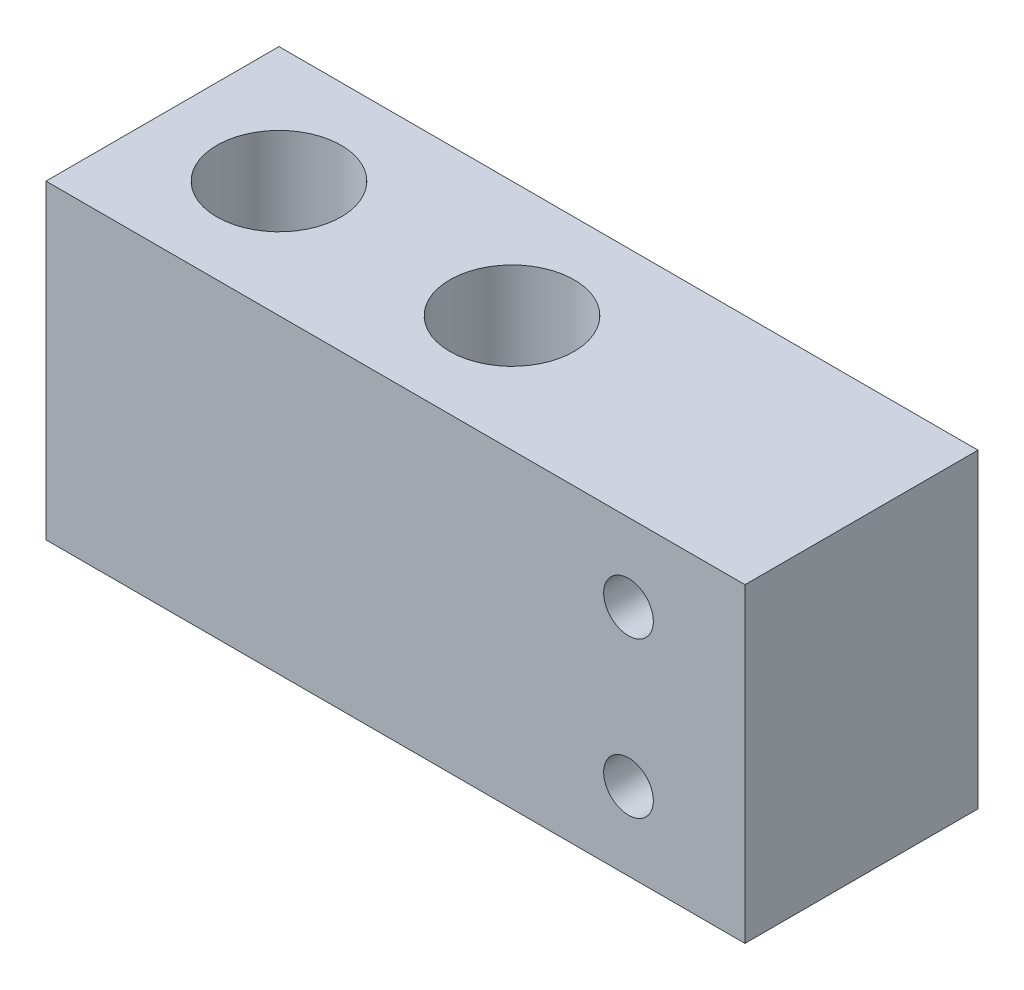
from build123d import *

# Parameters (mm, degrees)
SKETCH2_W           = 45
SKETCH2_H           = 15
SKETCH2_R           = 4
BOSS_EXTRUDE1_DEPTH = 10
BOSS_EXTRUDE2_START = -10
SKETCH2_3_W         = 45
SKETCH2_3_H         = 15
SKETCH2_3_R         = 4
BOSS_EXTRUDE2_DEPTH = 10
SKETCH4_R           = 1.6
CUT_EXTRUDE1_DEPTH  = 36
CUT_EXTRUDE2_START  = -6.25
SKETCH4_3_R         = 1.6
CUT_EXTRUDE2_DEPTH  = 2.5


with BuildPart() as part:
    # Sketch2 → Boss-Extrude1 (new body)
    with BuildSketch(Plane(origin=(0, 0, 0), x_dir=(1, 0, 0), z_dir=(0, 1, 0))):
        with Locations((7.5, 0)):
            Rectangle(SKETCH2_W, SKETCH2_H)
        with Locations((-7.5, 0)):
            Circle(SKETCH2_R, mode=Mode.SUBTRACT)
        with Locations((7.5, 0)):
            Circle(SKETCH2_R, mode=Mode.SUBTRACT)
    extrude(amount=BOSS_EXTRUDE1_DEPTH)

    # Sketch2<3> → Boss-Extrude2 (add)
    with BuildSketch(Plane(origin=(0, 0, 0), x_dir=(1, 0, 0), z_dir=(0, 1, 0)).offset(BOSS_EXTRUDE2_START)):
        with Locations((7.5, 0)):
            Rectangle(SKETCH2_3_W, SKETCH2_3_H)
        with Locations((-7.5, 0)):
            Circle(SKETCH2_3_R, mode=Mode.SUBTRACT)
        with Locations((7.5, 0)):
            Circle(SKETCH2_3_R, mode=Mode.SUBTRACT)
    extrude(amount=BOSS_EXTRUDE2_DEPTH)

    # Sketch4 → Cut-Extrude1 (cut, through all)
    with BuildSketch(Plane.XY.offset(7.5)):
        with Locations((22.5, 5)):
            Circle(SKETCH4_R)
        with Locations((22.5, -5)):
            Circle(SKETCH4_R)
        with Locations((-22.5, -5)):
            Circle(SKETCH4_R)
        with Locations((-22.5, 5)):
            Circle(SKETCH4_R)
    extrude(amount=-CUT_EXTRUDE1_DEPTH, mode=Mode.SUBTRACT)

    # Sketch4<3> → Cut-Extrude2 (cut)
    # profile 1 of 4: a face of its own
    with BuildSketch(Plane.XY.offset(7.5).offset(CUT_EXTRUDE2_START)):
        Polygon((-22.5, 8.435234102), (-25.475, 6.717617051), (-25.475, 3.282382949), (-22.5, 1.564765898), (-19.525, 3.282382949), (-19.525, 6.717617051), align=None)
        with Locations((-22.5, 5)):
            Circle(SKETCH4_3_R, mode=Mode.SUBTRACT)
    # profile 2 of 4: a face of its own
    with BuildSketch(Plane.XY.offset(7.5).offset(CUT_EXTRUDE2_START)):
        Polygon((22.5, 8.435234102), (19.525, 6.717617051), (19.525, 3.282382949), (22.5, 1.564765898), (25.475, 3.282382949), (25.475, 6.717617051), align=None)
        with Locations((22.5, 5)):
            Circle(SKETCH4_3_R, mode=Mode.SUBTRACT)
    # profile 3 of 4: a face of its own
    with BuildSketch(Plane.XY.offset(7.5).offset(CUT_EXTRUDE2_START)):
        Polygon((-22.5, -8.435234102), (-19.525, -6.717617051), (-19.525, -3.282382949), (-22.5, -1.564765898), (-25.475, -3.282382949), (-25.475, -6.717617051), align=None)
        with Locations((-22.5, -5)):
            Circle(SKETCH4_3_R, mode=Mode.SUBTRACT)
    # profile 4 of 4: a face of its own
    with BuildSketch(Plane.XY.offset(7.5).offset(CUT_EXTRUDE2_START)):
        Polygon((22.5, -8.435234102), (25.475, -6.717617051), (25.475, -3.282382949), (22.5, -1.564765898), (19.525, -3.282382949), (19.525, -6.717617051), align=None)
        with Locations((22.5, -5)):
            Circle(SKETCH4_3_R, mode=Mode.SUBTRACT)
    extrude(amount=-CUT_EXTRUDE2_DEPTH, mode=Mode.SUBTRACT)


solid = part.part
